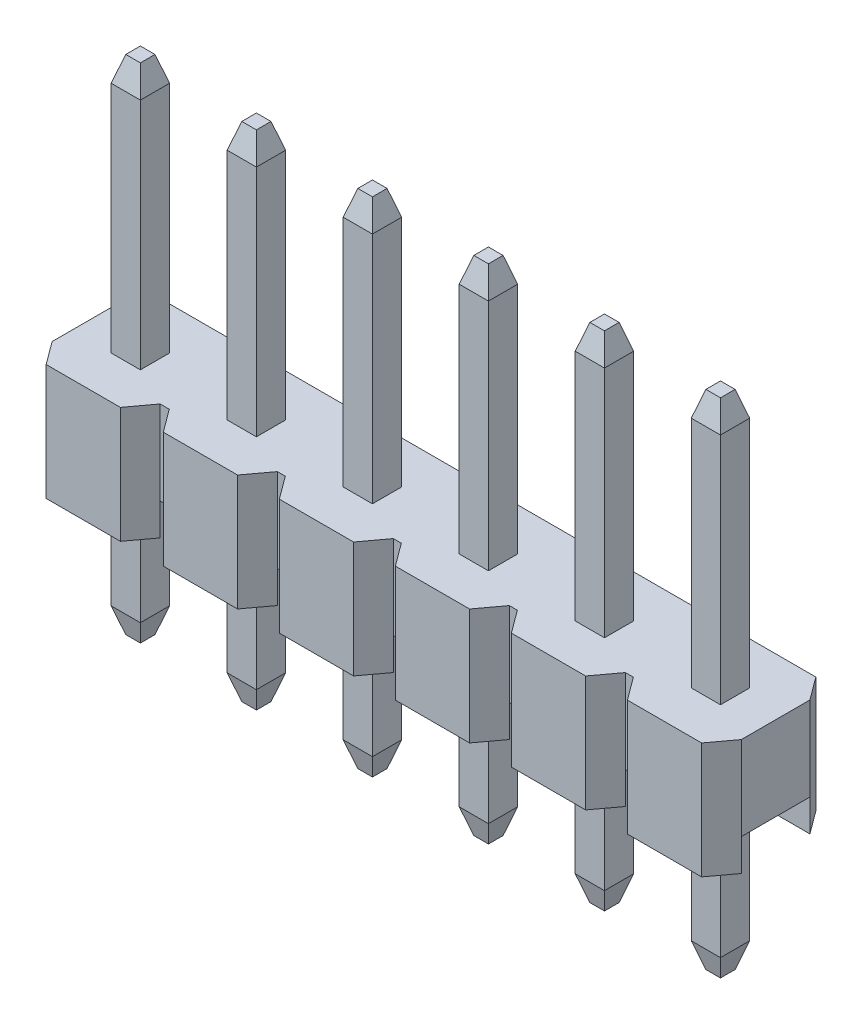
from build123d import *

# Parameters (mm, degrees)
BOSS_EXTRUDE3_DEPTH = 2.54
BOSS_EXTRUDE4_DEPTH = 2.54
LPATTERN1_COUNT     = 5
LPATTERN1_PITCH     = 2.54
SKETCH8_W           = 100
SKETCH8_H           = 1.5
CUT_EXTRUDE4_DEPTH  = 0.7
BOSS_EXTRUDE5_START = -8.2
SKETCH3_W           = 0.64
SKETCH3_H           = 0.64
BOSS_EXTRUDE5_DEPTH = 11
CHAMFER1_SIZE       = 0.16
CHAMFER1_SIZE2      = 0.5458
CHAMFER2_SIZE       = 0.16
CHAMFER2_SIZE2      = 0.5458
LPATTERN2_START     = 2.22
LPATTERN2_DEPTH     = 0.64
LPATTERN2_START_2   = 4.76
LPATTERN2_2_DEPTH   = 0.64
LPATTERN2_START_3   = 7.3
LPATTERN2_3_DEPTH   = 0.64
LPATTERN2_START_4   = 9.84
LPATTERN2_4_DEPTH   = 0.64
LPATTERN2_START_5   = 12.38
LPATTERN2_5_DEPTH   = 0.64
LPATTERN2_START_6   = -1
LPATTERN2_6_DEPTH   = 2


with BuildPart() as part:
    # Sketch6 → Boss-Extrude3 (new body)
    with BuildSketch(Plane(origin=(0, 0, 0), x_dir=(1, 0, 0), z_dir=(0, 1, 0))):
        Polygon((-1.1825, 0.75), (-1.1825, -0.75), (-0.812519462, -1.25), (0.812519462, -1.25), (1.1825, -0.75), (1.1825, 0.75), (0.812519462, 1.25), (-0.812519462, 1.25), align=None)
    extrude(amount=BOSS_EXTRUDE3_DEPTH)

    # Sketch7 → Boss-Extrude4 (add)
    with BuildSketch(Plane(origin=(0, 0, 0), x_dir=(1, 0, 0), z_dir=(0, 1, 0))):
        Polygon((1.1825, 0.75), (1.1825, -0.75), (1.3825, -0.75), (1.752480538, -1.25), (3.377519462, -1.25), (3.7475, -0.75), (3.7475, 0.75), (3.377519462, 1.25), (1.752480538, 1.25), (1.3825, 0.75), align=None)
    boss_extrude4 = extrude(amount=BOSS_EXTRUDE4_DEPTH)

    # LPattern1: Boss-Extrude4 ×5
    with Locations(*[(i * LPATTERN1_PITCH, 0, 0) for i in range(1, LPATTERN1_COUNT)]):
        add(boss_extrude4)

    # Sketch8 → Cut-Extrude4 (cut)
    with BuildSketch(Plane.XZ):
        with Locations((48.8175, 0)):
            Rectangle(SKETCH8_W, SKETCH8_H)
    extrude(amount=-CUT_EXTRUDE4_DEPTH, mode=Mode.SUBTRACT)

    # Sketch3 → Boss-Extrude5 (add)
    with BuildSketch(Plane(origin=(0, 0, 0), x_dir=(-1, 0, 0), z_dir=(0, -1, 0)).offset(BOSS_EXTRUDE5_START)):
        Rectangle(SKETCH3_W, SKETCH3_H)
    extrude(amount=BOSS_EXTRUDE5_DEPTH)

    # Chamfer1
    chamfer1_edges = [part.edges().sort_by_distance(p)[0] for p in [
        (-0.32, -2.8, 0),
        (0, -2.8, -0.32),
        (0.32, -2.8, 0),
        (0, -2.8, 0.32),
    ]]
    chamfer1_side = [part.faces().sort_by_distance(p)[0] for p in [
        (0, -2.8, 0),
    ]]
    chamfer(chamfer1_edges, length=CHAMFER1_SIZE, length2=CHAMFER1_SIZE2, reference=chamfer1_side[0])

    # Chamfer2
    chamfer2_edges = [part.edges().sort_by_distance(p)[0] for p in [
        (-0.32, 8.2, 0),
        (0, 8.2, 0.32),
        (0.32, 8.2, 0),
        (0, 8.2, -0.32),
    ]]
    chamfer2_side = [part.faces().sort_by_distance(p)[0] for p in [
        (0, 8.2, 0),
    ]]
    chamfer(chamfer2_edges, length=CHAMFER2_SIZE, length2=CHAMFER2_SIZE2, reference=chamfer2_side[0])

    # LPattern2: read off the stored shape, not the designer's step
    # LPattern2 outline → LPattern2 (add)
    with BuildSketch(Plane.YZ.offset(LPATTERN2_START)):
        Polygon((-2.2542, 0.32), (-2.8, 0.16), (-2.8, -0.16), (-2.2542, -0.32), (0.7, -0.32), (0.7, 0.32), align=None)
        Polygon((2.54, 0.32), (2.54, -0.32), (7.6542, -0.32), (8.2, -0.16), (8.2, 0.16), (7.6542, 0.32), align=None)
    extrude(amount=LPATTERN2_DEPTH)

    # LPattern2 2 outline → LPattern2 2 (add)
    with BuildSketch(Plane.YZ.offset(LPATTERN2_START_2)):
        Polygon((-2.2542, 0.32), (-2.8, 0.16), (-2.8, -0.16), (-2.2542, -0.32), (0.7, -0.32), (0.7, 0.32), align=None)
        Polygon((2.54, 0.32), (2.54, -0.32), (7.6542, -0.32), (8.2, -0.16), (8.2, 0.16), (7.6542, 0.32), align=None)
    extrude(amount=LPATTERN2_2_DEPTH)

    # LPattern2 3 outline → LPattern2 3 (add)
    with BuildSketch(Plane.YZ.offset(LPATTERN2_START_3)):
        Polygon((-2.2542, 0.32), (-2.8, 0.16), (-2.8, -0.16), (-2.2542, -0.32), (0.7, -0.32), (0.7, 0.32), align=None)
        Polygon((2.54, 0.32), (2.54, -0.32), (7.6542, -0.32), (8.2, -0.16), (8.2, 0.16), (7.6542, 0.32), align=None)
    extrude(amount=LPATTERN2_3_DEPTH)

    # LPattern2 4 outline → LPattern2 4 (add)
    with BuildSketch(Plane.YZ.offset(LPATTERN2_START_4)):
        Polygon((-2.2542, 0.32), (-2.8, 0.16), (-2.8, -0.16), (-2.2542, -0.32), (0.7, -0.32), (0.7, 0.32), align=None)
        Polygon((2.54, 0.32), (2.54, -0.32), (7.6542, -0.32), (8.2, -0.16), (8.2, 0.16), (7.6542, 0.32), align=None)
    extrude(amount=LPATTERN2_4_DEPTH)

    # LPattern2 5 outline → LPattern2 5 (add)
    with BuildSketch(Plane.YZ.offset(LPATTERN2_START_5)):
        Polygon((-2.2542, 0.32), (-2.8, 0.16), (-2.8, -0.16), (-2.2542, -0.32), (0.7, -0.32), (0.7, 0.32), align=None)
        Polygon((2.54, 0.32), (2.54, -0.32), (7.6542, -0.32), (8.2, -0.16), (8.2, 0.16), (7.6542, 0.32), align=None)
    extrude(amount=LPATTERN2_5_DEPTH)

    # LPattern2 6 outline → LPattern2 6 (cut)
    with BuildSketch(Plane.XY.offset(LPATTERN2_START_6)):
        Polygon((2.86, -2.8), (2.86, -2.2542), (2.7, -2.8), align=None)
        Polygon((2.22, -2.8), (2.38, -2.8), (2.22, -2.2542), align=None)
        Polygon((4.76, -2.8), (4.92, -2.8), (4.76, -2.2542), align=None)
        Polygon((5.4, -2.2542), (5.24, -2.8), (5.4, -2.8), align=None)
        Polygon((7.3, -2.8), (7.46, -2.8), (7.3, -2.2542), align=None)
        Polygon((7.94, -2.2542), (7.78, -2.8), (7.94, -2.8), align=None)
        Polygon((9.84, -2.8), (10, -2.8), (9.84, -2.2542), align=None)
        Polygon((10.48, -2.2542), (10.32, -2.8), (10.48, -2.8), align=None)
        Polygon((12.38, -2.8), (12.54, -2.8), (12.38, -2.2542), align=None)
        Polygon((13.02, -2.2542), (12.86, -2.8), (13.02, -2.8), align=None)
        Polygon((2.22, 7.6542), (2.38, 8.2), (2.22, 8.2), align=None)
        Polygon((2.86, 8.2), (2.7, 8.2), (2.86, 7.6542), align=None)
        Polygon((4.76, 7.6542), (4.92, 8.2), (4.76, 8.2), align=None)
        Polygon((5.24, 8.2), (5.4, 7.6542), (5.4, 8.2), align=None)
        Polygon((7.3, 7.6542), (7.46, 8.2), (7.3, 8.2), align=None)
        Polygon((7.78, 8.2), (7.94, 7.6542), (7.94, 8.2), align=None)
        Polygon((9.84, 7.6542), (10, 8.2), (9.84, 8.2), align=None)
        Polygon((10.32, 8.2), (10.48, 7.6542), (10.48, 8.2), align=None)
        Polygon((12.38, 7.6542), (12.54, 8.2), (12.38, 8.2), align=None)
        Polygon((12.86, 8.2), (13.02, 7.6542), (13.02, 8.2), align=None)
    extrude(amount=LPATTERN2_6_DEPTH, mode=Mode.SUBTRACT)


solid = part.part
